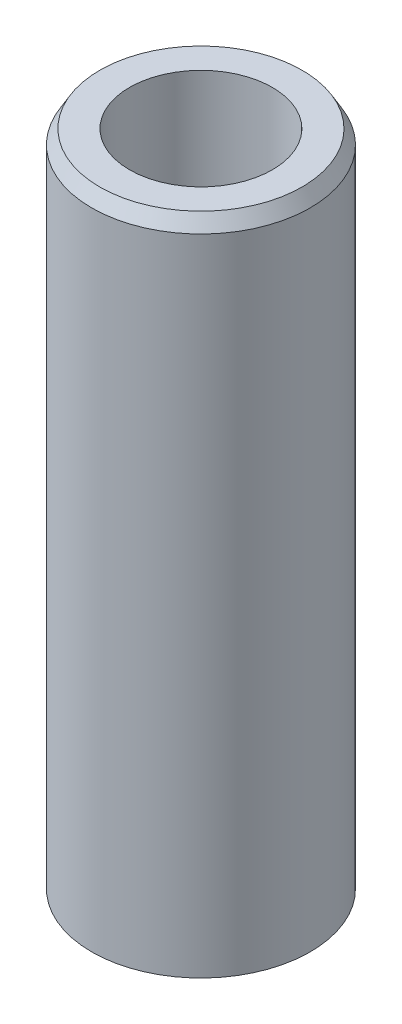
from build123d import *
from OCP.BRepFilletAPI import BRepFilletAPI_MakeChamfer

# Parameters (mm, degrees)
SKETCH1_R           = 35
BOSS_EXTRUDE1_DEPTH = 213.468186097
SKETCH2_R           = 22.874463984
CUT_EXTRUDE1_DEPTH  = 220.131619069
CHAMFER1_SIZE       = 4.495049272
CHAMFER1_SIZE2      = 2.595217907


with BuildPart() as part:
    # Sketch1 → Boss-Extrude1 (new body)
    with BuildSketch(Plane(origin=(0, 0, 0), x_dir=(1, 0, 0), z_dir=(0, 1, 0))):
        Circle(SKETCH1_R)
    extrude(amount=BOSS_EXTRUDE1_DEPTH)

    # Sketch2 → Cut-Extrude1 (cut, through all)
    with BuildSketch(Plane(origin=(0, 0, 0), x_dir=(1, 0, 0), z_dir=(0, 1, 0))):
        Circle(SKETCH2_R)
    extrude(amount=CUT_EXTRUDE1_DEPTH, mode=Mode.SUBTRACT)

    # Chamfer1: one chamfer whose edges measure the first distance from different faces: ONE call of the kernel's chamfer builder (chamfer() names one face for all edges)
    chamfer1_edges_1 = [part.edges().sort_by_distance(p)[0] for p in [
        (-35, 213.468186097, 0),
    ]]
    chamfer1_side_1 = [part.faces().sort_by_distance(p)[0] for p in [
        (-35, 106.734093049, 0),
    ]]
    chamfer1_edges_2 = [part.edges().sort_by_distance(p)[0] for p in [
        (-35, 0, 0),
    ]]
    chamfer1_side_2 = [part.faces().sort_by_distance(p)[0] for p in [
        (-34.010050506, 0, 0),
    ]]
    chamfer1 = BRepFilletAPI_MakeChamfer(part.part.solid().wrapped)
    for e in chamfer1_edges_1:
        chamfer1.Add(CHAMFER1_SIZE, CHAMFER1_SIZE2, e.wrapped, chamfer1_side_1[0].wrapped)  # the first distance lies on this face
    for e in chamfer1_edges_2:
        chamfer1.Add(CHAMFER1_SIZE, CHAMFER1_SIZE2, e.wrapped, chamfer1_side_2[0].wrapped)  # the first distance lies on this face
    add(Compound.cast(chamfer1.Shape()), mode=Mode.REPLACE)


solid = part.part
